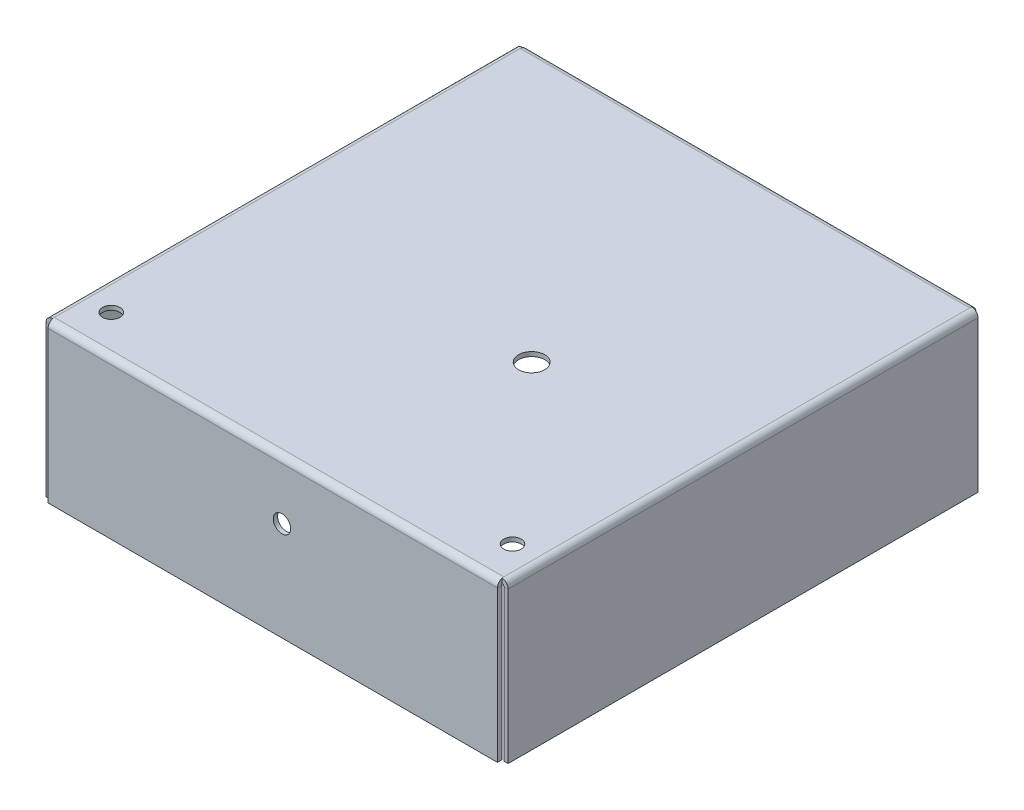
from build123d import *

# Parameters (mm, degrees)
BASE_FLANGE1_DEPTH           = 171.45
SKETCH4_R                    = 4.7625
CUT_EXTRUDE1_DEPTH           = 1.5875
EDGE_FLANGE2_STRIP_W         = 7.8232
EDGE_FLANGE2_STRIP_H         = 1.5875
EDGE_FLANGE2_STRIP_CUT_DEPTH = 164.0078
EDGE_FLANGE2_DEPTH           = 164.0078
EDGE_FLANGE3_STRIP_W         = 7.8232
EDGE_FLANGE3_STRIP_H         = 1.5875
EDGE_FLANGE3_STRIP_CUT_DEPTH = 164.0078
EDGE_FLANGE3_DEPTH           = 164.0078
SKETCH14_R                   = 3.175
CUT_EXTRUDE2_DEPTH           = 1.5875
SKETCH17_R                   = 3.175
CUT_EXTRUDE5_DEPTH           = 1.5875


# Sheet-metal steps are written as plain solids
with BuildPart() as part:
    # Sketch1 → Base-Flange1 (new body)
    with BuildSketch(Plane.XY):
        with BuildLine():
            Line((0, -55.88), (0, -0.7366))
            ThreePointArc((0, -0.7366), (0.215745145, -0.215745145), (0.7366, 0))
            Line((0.7366, 0), (164.7444, 0))
            ThreePointArc((164.7444, 0), (165.265254855, -0.215745145), (165.481, -0.7366))
            Line((165.481, -0.7366), (165.481, -55.88))
            Line((165.481, -55.88), (167.0685, -55.88))
            Line((167.0685, -55.88), (167.0685, -0.7366))
            ThreePointArc((167.0685, -0.7366), (166.38778687, 0.90678687), (164.7444, 1.5875))
            Line((164.7444, 1.5875), (0.7366, 1.5875))
            ThreePointArc((0.7366, 1.5875), (-0.90678687, 0.90678687), (-1.5875, -0.7366))
            Line((-1.5875, -0.7366), (-1.5875, -55.88))
            Line((-1.5875, -55.88), (0, -55.88))
        make_face()
    extrude(amount=BASE_FLANGE1_DEPTH)

    # Sketch4 → Cut-Extrude1 (cut)
    with BuildSketch(Plane(origin=(0, 1.5875, 0), x_dir=(1, 0, 0), z_dir=(0, 1, 0))):
        with Locations(Location((101.981, -97.79, 0), (0, 0, 270))):
            Circle(SKETCH4_R)
    extrude(amount=-CUT_EXTRUDE1_DEPTH, mode=Mode.SUBTRACT)

    # Edge-Flange2 strip (across the edge) → Edge-Flange2 strip cut (cut)
    with BuildSketch(Plane(origin=(164.7444, 0, 171.45), x_dir=(0, 0, -1), z_dir=(-1, 0, 0))):
        with Locations((-3.175, -0.79375)):
            Rectangle(EDGE_FLANGE2_STRIP_W, EDGE_FLANGE2_STRIP_H)
    extrude(amount=EDGE_FLANGE2_STRIP_CUT_DEPTH, mode=Mode.SUBTRACT)

    # Edge-Flange2 section (across the edge) → Edge-Flange2 (add)
    with BuildSketch(Plane(origin=(164.7444, 0, 171.45), x_dir=(0, 0, -1), z_dir=(-1, 0, 0))):
        with BuildLine():
            Line((-1.5875, 0.7366), (-1.5875, 55.88))
            Line((-1.5875, 55.88), (0, 55.88))
            Line((0, 55.88), (0, 0.7366))
            ThreePointArc((0, 0.7366), (0.215745145, 0.215745145), (0.7366, 0))
            Line((0.7366, 0), (0.7366, -1.5875))
            ThreePointArc((0.7366, -1.5875), (-0.90678687, -0.90678687), (-1.5875, 0.7366))
        make_face()
    extrude(amount=EDGE_FLANGE2_DEPTH)

    # Edge-Flange3 strip (across the edge) → Edge-Flange3 strip cut (cut)
    with BuildSketch(Plane(origin=(0.7366, 0, 0), x_dir=(0, 0, 1), z_dir=(1, 0, 0))):
        with Locations((-3.175, -0.79375)):
            Rectangle(EDGE_FLANGE3_STRIP_W, EDGE_FLANGE3_STRIP_H)
    extrude(amount=EDGE_FLANGE3_STRIP_CUT_DEPTH, mode=Mode.SUBTRACT)

    # Edge-Flange3 section (across the edge) → Edge-Flange3 (add)
    with BuildSketch(Plane(origin=(0.7366, 0, 0), x_dir=(0, 0, 1), z_dir=(1, 0, 0))):
        with BuildLine():
            Line((-1.5875, 0.7366), (-1.5875, 55.88))
            Line((-1.5875, 55.88), (0, 55.88))
            Line((0, 55.88), (0, 0.7366))
            ThreePointArc((0, 0.7366), (0.215745145, 0.215745145), (0.7366, 0))
            Line((0.7366, 0), (0.7366, -1.5875))
            ThreePointArc((0.7366, -1.5875), (-0.90678687, -0.90678687), (-1.5875, 0.7366))
        make_face()
    extrude(amount=EDGE_FLANGE3_DEPTH)

    # Sketch14 → Cut-Extrude2 (cut)
    with BuildSketch(Plane(origin=(0, 1.5875, 0), x_dir=(1, 0, 0), z_dir=(0, 1, 0))):
        with Locations(Location((155.956, -158.75, 0), (0, 0, 270))):
            Circle(SKETCH14_R)
        with Locations(Location((9.525, -158.75, 0), (0, 0, 270))):
            Circle(SKETCH14_R)
    extrude(amount=-CUT_EXTRUDE2_DEPTH, mode=Mode.SUBTRACT)

    # Sketch17 → Cut-Extrude5 (cut)
    with BuildSketch(Plane.XY.offset(173.0375)):
        with Locations((86.106, -19.7866)):
            Circle(SKETCH17_R)
    extrude(amount=-CUT_EXTRUDE5_DEPTH, mode=Mode.SUBTRACT)


solid = part.part
